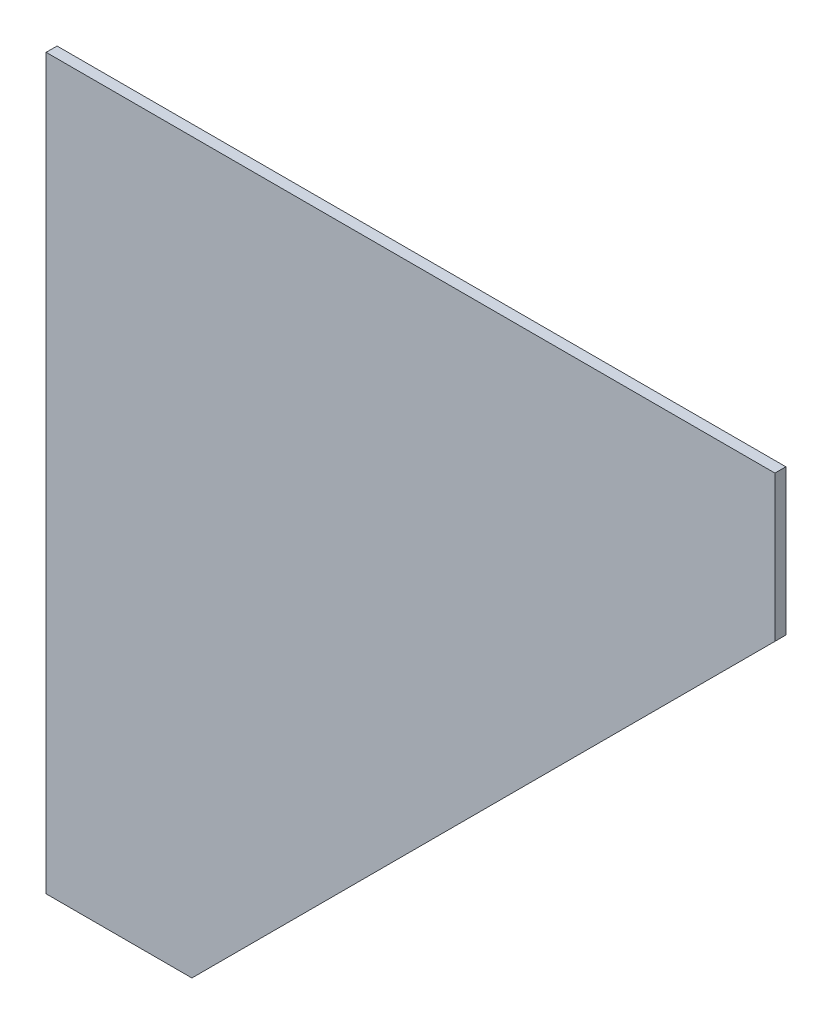
from build123d import *

# Parameters (mm, degrees)
ESTRUSIONE_ESTRUSIONE1_DEPTH = 3


with BuildPart() as part:
    # Schizzo1 → Estrusione-Estrusione1 (new body)
    with BuildSketch(Plane.XY):
        Polygon((0, 0), (0, 200), (200, 200), (200, 160), (40, 0), align=None)
    extrude(amount=ESTRUSIONE_ESTRUSIONE1_DEPTH)


solid = part.part
